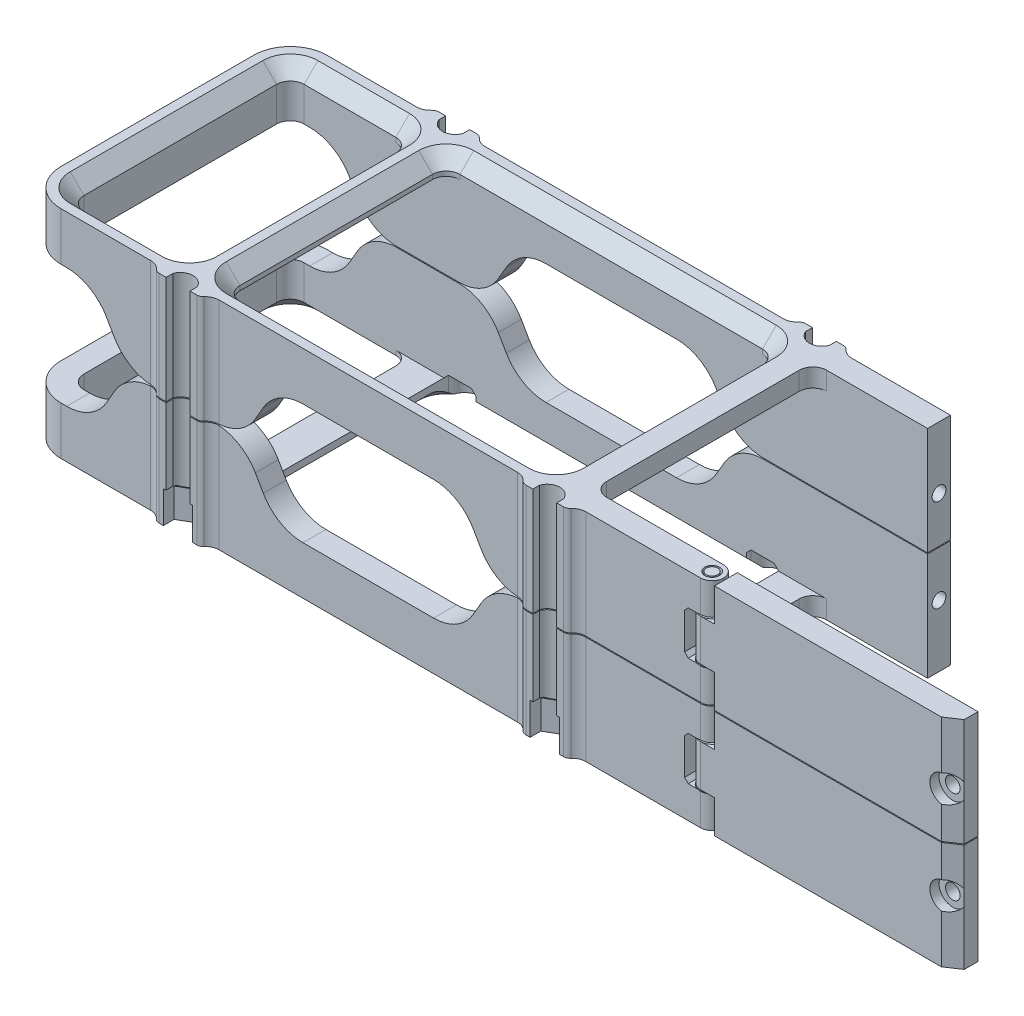
from build123d import *

# Parameters (mm, degrees)
DODANIE_WYCI_GNI_CIE1_DEPTH  = 23.5
WYTNIJ_WYCI_GNI_CIE1_DEPTH   = 86.874385005
ZAOKR_GLENIE1_R              = 8
ZAOKR_GLENIE2_R              = 3
ZAOKR_GLENIE3_R              = 3
SZKIC6_R                     = 1.6
WYTNIJ_WYCI_GNI_CIE4_DEPTH   = 85.305990297
SZKIC7_W                     = 6
SZKIC7_H                     = 9.5
WYTNIJ_WYCI_GNI_CIE5_DEPTH   = 99.577380773
SFAZOWANIE1_SIZE             = 1
SZKIC8_R                     = 1.25
DODANIE_WYCI_GNI_CIE2_DEPTH  = 23.5
SZKIC9_R                     = 2.5
DODANIE_WYCI_GNI_CIE3_DEPTH  = 9.1
SFAZOWANIE2_SIZE             = 1.25
DODANIE_WYCI_GNI_CIE4_DEPTH  = 23.5
DODANIE_WYCI_GNI_CIE5_DEPTH  = 9.1
ZAOKR_GLENIE4_R              = 2.5
SZKIC13_R                    = 1.6
WYTNIJ_WYCI_GNI_CIE6_DEPTH   = 5
SZKIC14_R                    = 1.5
WYTNIJ_WYCI_GNI_CIE7_DEPTH   = 10
SFAZOWANIE3_SIZE             = 2
SFAZOWANIE3_SIZE_2           = 3
SZKIC15_R                    = 3
WYTNIJ_WYCI_GNI_CIE8_DEPTH   = 2
SFAZOWANIE4_SIZE             = 0.8
OBIEKT_PRZENIE_KOPIUJ1_ANGLE = 90
DODANIE_WYCI_GNI_CIE6_DEPTH  = 4
WYTNIJ_WYCI_GNI_CIE9_DEPTH   = 144.096121557
WYTNIJ_WYCI_GNI_CIE10_DEPTH  = 144.096121557
ZAOKR_GLENIE5_R              = 10
ZAOKR_GLENIE6_R              = 3
SFAZOWANIE5_SIZE             = 3
WYTNIJ_WYCI_GNI_CIE11_DEPTH  = 7
SFAZOWANIE6_SIZE             = 0.7
WYTNIJ_WYCI_GNI_CIE12_DEPTH  = 5
SFAZOWANIE7_SIZE             = 1


# Some blends are built 0.0001 mm under size
with BuildPart() as part:
    # Szkic1 → Dodanie-wyciągnięcie1 (new body)
    with BuildSketch(Plane(origin=(0, 0, 0), x_dir=(1, 0, 0), z_dir=(0, 1, 0))):
        with BuildLine():
            Line((-70, -24), (75, -24))
            Line((75, -24), (75, -29))
            Line((75, -29), (45.6, -29))
            ThreePointArc((45.6, -29), (40, -34.6), (34.4, -29))
            Line((34.4, -29), (-34.4, -29))
            ThreePointArc((-34.4, -29), (-40, -34.6), (-45.6, -29))
            Line((-45.6, -29), (-75, -29))
            Line((-75, -29), (-75, -24))
            Line((-75, -24), (-75, 24))
            Line((-75, 24), (-75, 29))
            Line((-75, 29), (-45.6, 29))
            ThreePointArc((-45.6, 29), (-40, 34.6), (-34.4, 29))
            Line((-34.4, 29), (34.4, 29))
            ThreePointArc((34.4, 29), (40, 34.6), (45.6, 29))
            Line((45.6, 29), (69, 29))
            Line((69, 29), (69, 24))
            Line((69, 24), (-70, 24))
            Line((-70, 24), (-70, -24))
        make_face()
    extrude(amount=DODANIE_WYCI_GNI_CIE1_DEPTH)

    # Szkic2 → Wytnij-wyciągnięcie1 (cut, through all)
    with BuildSketch(Plane(origin=(0, 23.5, 0), x_dir=(1, 0, 0), z_dir=(0, 1, 0))):
        with BuildLine():
            Line((-44.1, -30.5), (-42.6, -30.5))
            Line((-42.6, -30.5), (-42.6, -29))
            ThreePointArc((-42.6, -29), (-40, -27.214322345), (-37.4, -29))
            Line((-37.4, -29), (-37.4, -30.5))
            Line((-37.4, -30.5), (-35.9, -30.5))
            ThreePointArc((-35.9, -30.5), (-34.839339828, -30.060660172), (-34.4, -29))
            ThreePointArc((-34.4, -29), (-40, -34.6), (-45.6, -29))
            ThreePointArc((-45.6, -29), (-45.160660172, -30.060660172), (-44.1, -30.5))
        make_face()
        with BuildLine():
            Line((-37.4, 30.5), (-35.9, 30.5))
            ThreePointArc((-35.9, 30.5), (-34.839339828, 30.060660172), (-34.4, 29))
            ThreePointArc((-34.4, 29), (-40, 34.6), (-45.6, 29))
            ThreePointArc((-45.6, 29), (-45.160660172, 30.060660172), (-44.1, 30.5))
            Line((-44.1, 30.5), (-42.6, 30.5))
            Line((-42.6, 30.5), (-42.6, 29))
            ThreePointArc((-42.6, 29), (-40, 27.214322345), (-37.4, 29))
            Line((-37.4, 29), (-37.4, 30.5))
        make_face()
        with BuildLine():
            Line((44.1, 30.5), (42.6, 30.5))
            Line((42.6, 30.5), (42.6, 29))
            ThreePointArc((42.6, 29), (40, 27.214322345), (37.4, 29))
            Line((37.4, 29), (37.4, 30.5))
            Line((37.4, 30.5), (35.9, 30.5))
            ThreePointArc((35.9, 30.5), (34.839339828, 30.060660172), (34.4, 29))
            ThreePointArc((34.4, 29), (40, 34.6), (45.6, 29))
            ThreePointArc((45.6, 29), (45.160660172, 30.060660172), (44.1, 30.5))
        make_face()
        with BuildLine():
            Line((37.4, -30.5), (35.9, -30.5))
            ThreePointArc((35.9, -30.5), (34.839339828, -30.060660172), (34.4, -29))
            ThreePointArc((34.4, -29), (40, -34.6), (45.6, -29))
            ThreePointArc((45.6, -29), (45.160660172, -30.060660172), (44.1, -30.5))
            Line((44.1, -30.5), (42.6, -30.5))
            Line((42.6, -30.5), (42.6, -29))
            ThreePointArc((42.6, -29), (40, -27.214322345), (37.4, -29))
            Line((37.4, -29), (37.4, -30.5))
        make_face()
    extrude(amount=-WYTNIJ_WYCI_GNI_CIE1_DEPTH, mode=Mode.SUBTRACT)

    # Zaokrąglenie1
    zaokr_glenie1_edges = [part.edges().sort_by_distance(p)[0] for p in [
        (-75, 11.75, 29),
        (-75, 11.75, -29),
    ]]
    fillet(zaokr_glenie1_edges, radius=ZAOKR_GLENIE1_R)

    # Zaokrąglenie2
    zaokr_glenie2_edges = [part.edges().sort_by_distance(p)[0] for p in [
        (-70, 11.75, -24),
        (-70, 11.75, 24),
    ]]
    fillet(zaokr_glenie2_edges, radius=ZAOKR_GLENIE2_R)

    # Zaokrąglenie3
    zaokr_glenie3_edges = [part.edges().sort_by_distance(p)[0] for p in [
        (45.6, 11.75, 29),
        (34.4, 11.75, 29),
        (-34.4, 11.75, 29),
        (-45.6, 11.75, 29),
        (-45.6, 11.75, -29),
        (-34.4, 11.75, -29),
        (34.4, 11.75, -29),
        (45.6, 11.75, -29),
    ]]
    fillet(zaokr_glenie3_edges, radius=ZAOKR_GLENIE3_R)

    # Szkic6 → Wytnij-wyciągnięcie4 (cut, through all)
    with BuildSketch(Plane(origin=(0, 23.5, 0), x_dir=(1, 0, 0), z_dir=(0, 1, 0))):
        with Locations(Location((72.5, -26.5, 0), (0, 0, 270))):
            Circle(SZKIC6_R)
    extrude(amount=-WYTNIJ_WYCI_GNI_CIE4_DEPTH, mode=Mode.SUBTRACT)

    # Szkic7 → Wytnij-wyciągnięcie5 (cut, through all)
    with BuildSketch(Plane.XY.offset(29)):
        with Locations((72, 11.75)):
            Rectangle(SZKIC7_W, SZKIC7_H)
    extrude(amount=-WYTNIJ_WYCI_GNI_CIE5_DEPTH, mode=Mode.SUBTRACT)

    # Sfazowanie1
    # the kernel refuses this chamfer: 1 mm, written as the material it takes off along each edge
    with BuildSketch(Plane(origin=(72.5, 7, 26.5), x_dir=(0, 0, 1), z_dir=(-1, 0, 0))) as sfazowanie1_piece_1:
        Polygon((1.6, -SFAZOWANIE1_SIZE), (1.6 + SFAZOWANIE1_SIZE, 0), (1.6, 0), align=None)
    revolve(axis=Axis((72.5, 7, 26.5), (0, 1, 0)), mode=Mode.SUBTRACT)
    with BuildSketch(Plane(origin=(72.5, 16.5, 26.5), x_dir=(0, 0, 1), z_dir=(-1, 0, 0))) as sfazowanie1_piece_2:
        Polygon((1.6 + SFAZOWANIE1_SIZE, 0), (1.6, SFAZOWANIE1_SIZE), (1.6, 0), align=None)
    revolve(axis=Axis((72.5, 16.5, 26.5), (0, 1, 0)), mode=Mode.SUBTRACT)

    # Zaokrąglenie4
    zaokr_glenie4_edges = [part.edges().sort_by_distance(p)[0] for p in [
        (75, 3.5, 24),
        (75, 3.5, 29),
        (75, 20, 29),
        (75, 20, 24),
    ]]
    fillet(zaokr_glenie4_edges, radius=ZAOKR_GLENIE4_R - 0.0001)  # a hair under: the kernel refuses the full size

    # Szkic14 → Wytnij-wyciągnięcie7 (cut)
    with BuildSketch(Plane(origin=(69, 0, 0), x_dir=(0, 0, -1), z_dir=(1, 0, 0))):
        with Locations((26.5, 13.5)):
            Circle(SZKIC14_R)
    extrude(amount=-WYTNIJ_WYCI_GNI_CIE7_DEPTH, mode=Mode.SUBTRACT)

    # Sfazowanie4
    sfazowanie4_edges = [part.edges().sort_by_distance(p)[0] for p in [
        (69, 7, 26.5),
        (69, 16.5, 26.5),
    ]]
    chamfer(sfazowanie4_edges, length=SFAZOWANIE4_SIZE)

    # Szkic16 → Dodanie-wyciągnięcie6 (add)
    with BuildSketch(Plane.XZ):
        Polygon((44, 24), (44, -24), (40, -24), (36, -24), (36, 24), align=None)
        Polygon((-44, -24), (-40, -24), (-36, -24), (-36, 24), (-44, 24), align=None)
    extrude(amount=-DODANIE_WYCI_GNI_CIE6_DEPTH)

    # Szkic17 → Wytnij-wyciągnięcie9 (cut, through all)
    with BuildSketch(Plane.XY.offset(29)):
        Polygon((-75, 10.5), (-60, 10.5), (-52.494446501, 23.5), (-75, 23.5), align=None)
    extrude(amount=-WYTNIJ_WYCI_GNI_CIE9_DEPTH, mode=Mode.SUBTRACT)

    # Szkic18 → Wytnij-wyciągnięcie10 (cut, through all)
    with BuildSketch(Plane.XY.offset(29)):
        Polygon((-27.505553499, 23.5), (-20, 10.5), (20, 10.5), (27.505553499, 23.5), align=None)
    extrude(amount=-WYTNIJ_WYCI_GNI_CIE10_DEPTH, mode=Mode.SUBTRACT)

    # Zaokrąglenie5
    zaokr_glenie5_edges = [part.edges().sort_by_distance(p)[0] for p in [
        (-52.494446501, 23.5, -26.5),
        (-52.494446501, 23.5, 26.5),
        (-27.505553499, 23.5, 26.5),
        (-20, 10.5, 26.5),
        (20, 10.5, 26.5),
        (27.505553499, 23.5, 26.5),
        (-27.505553499, 23.5, -26.5),
        (-20, 10.5, -26.5),
        (20, 10.5, -26.5),
        (27.505553499, 23.5, -26.5),
        (-60, 10.5, -26.5),
        (-60, 10.5, 26.5),
    ]]
    fillet(zaokr_glenie5_edges, radius=ZAOKR_GLENIE5_R)

    # Zaokrąglenie6
    zaokr_glenie6_edges = [part.edges().sort_by_distance(p)[0] for p in [
        (36, 2, -24),
        (36, 2, 24),
        (44, 2, 24),
        (44, 2, -24),
        (-44, 2, -24),
        (-44, 2, 24),
        (-36, 2, 24),
        (-36, 2, -24),
    ]]
    fillet(zaokr_glenie6_edges, radius=ZAOKR_GLENIE6_R)

    # Sfazowanie5
    sfazowanie5_edges = [part.edges().sort_by_distance(p)[0] for p in [
        (-57, 0, -24),
        (-70, 0, 0),
        (-69.121320344, 0, -23.121320344),
        (-69.121320344, 0, 23.121320344),
        (-44, 0, 0),
        (0, 0, -24),
        (0, 0, 24),
        (-57, 0, 24),
        (-36, 0, 0),
        (36, 0, 0),
        (-44.878679656, 0, -23.121320344),
        (-44.878679656, 0, 23.121320344),
        (-35.121320344, 0, 23.121320344),
        (-35.121320344, 0, -23.121320344),
        (35.121320344, 0, -23.121320344),
        (35.121320344, 0, 23.121320344),
    ]]
    chamfer(sfazowanie5_edges, length=SFAZOWANIE5_SIZE)


with BuildPart() as body_2:
    # Szkic8 → Dodanie-wyciągnięcie2 (new body)
    with BuildSketch(Plane.XZ):
        with Locations(Location((72.5, 26.5, 0), (0, 0, 270))):
            Circle(SZKIC8_R)
    extrude(amount=-DODANIE_WYCI_GNI_CIE2_DEPTH)

    # Szkic9 → Dodanie-wyciągnięcie3 (add)
    with BuildSketch(Plane(origin=(0, 7.2, 0), x_dir=(1, 0, 0), z_dir=(0, 1, 0))):
        with Locations(Location((72.5, -26.5, 0), (0, 0, 180))):
            Circle(SZKIC9_R)
    extrude(amount=DODANIE_WYCI_GNI_CIE3_DEPTH)

    # Sfazowanie2
    sfazowanie2_edges = [body_2.edges().sort_by_distance(p)[0] for p in [
        (72.5, 16.3, 27.75),
        (72.5, 7.2, 27.75),
    ]]
    chamfer(sfazowanie2_edges, length=SFAZOWANIE2_SIZE - 0.0001)  # a hair under: the kernel refuses the full size



with BuildPart() as body_3:
    # Szkic10 → Dodanie-wyciągnięcie4 (new body)
    with BuildSketch(Plane(origin=(0, 0, 0), x_dir=(1, 0, 0), z_dir=(0, 1, 0))):
        Polygon((70, 0), (70, 29), (75, 29), (75, -23.5), (70, -23.5), align=None)
    extrude(amount=DODANIE_WYCI_GNI_CIE4_DEPTH)


with BuildPart() as body_2_1:
    add(body_2.part)

    add(body_3.part)  # Dodanie-wyciągnięcie5 merges body 3
    # Szkic12 → Dodanie-wyciągnięcie5 (add)
    with BuildSketch(Plane(origin=(0, 7.2, 0), x_dir=(1, 0, 0), z_dir=(0, 1, 0))):
        with BuildLine():
            Line((75, -26.5), (75, -23.5))
            Line((75, -23.5), (70, -23.5))
            Line((70, -23.5), (70, -26.5))
            ThreePointArc((70, -26.5), (72.5, -29), (75, -26.5))
        make_face()
    extrude(amount=DODANIE_WYCI_GNI_CIE5_DEPTH)

    # Szkic13 → Wytnij-wyciągnięcie6 (cut)
    with BuildSketch(Plane(origin=(75, 0, 0), x_dir=(0, 0, -1), z_dir=(1, 0, 0))):
        with Locations((26.5, 13.5)):
            Circle(SZKIC13_R)
    extrude(amount=-WYTNIJ_WYCI_GNI_CIE6_DEPTH, mode=Mode.SUBTRACT)

    # Sfazowanie3
    # the kernel refuses this chamfer: 3, 2 mm, written as the material it takes off along each edge
    with BuildSketch(Plane(origin=(75, -7.751401572, -29), x_dir=(-0.9988348699755197, 0, -0.04825870409559825), z_dir=(0, 1, 0))) as sfazowanie3_piece_1:
        Polygon((SFAZOWANIE3_SIZE * 0.998834869976, SFAZOWANIE3_SIZE * 0.0482587040956), (-SFAZOWANIE3_SIZE_2 * 0.0482587040956, SFAZOWANIE3_SIZE_2 * 0.998834869976), (0, 0), align=None)
    extrude(amount=39.002803143, mode=Mode.SUBTRACT)

    # Szkic15 → Wytnij-wyciągnięcie8 (cut)
    with BuildSketch(Plane(origin=(75, 0, 0), x_dir=(0, 0, -1), z_dir=(1, 0, 0))):
        with Locations((26.5, 13.5)):
            Circle(SZKIC15_R)
    extrude(amount=-WYTNIJ_WYCI_GNI_CIE8_DEPTH, mode=Mode.SUBTRACT)


with BuildPart() as body_2_2:
    # Obiekt-Przenieś/Kopiuj1: moved
    add(body_2_1.part.rotate(Axis((72.5, 0, 26.5), (0, -1, 0)), OBIEKT_PRZENIE_KOPIUJ1_ANGLE))


with BuildPart() as body_3_2:
    # Lustro1: mirrored copy
    add(part.part.mirror(Plane.ZX.offset(23.6)))


with BuildPart() as body_4:
    # Lustro1 2: mirrored copy
    add(body_2_2.part.mirror(Plane.ZX.offset(23.6)))


with BuildPart() as part_1:
    add(part.part)

    # Szkic19 → Wytnij-wyciągnięcie11 (cut)
    with BuildSketch(Plane.XZ):
        Polygon((40, -26.304958277), (36.8, -28.152479139), (36.8, -31.847520861), (40, -33.695041723), (43.2, -31.847520861), (43.2, -28.152479139), align=None)
        Polygon((-40, -26.304958277), (-43.2, -28.152479139), (-43.2, -31.847520861), (-40, -33.695041723), (-36.8, -31.847520861), (-36.8, -28.152479139), align=None)
        Polygon((-40, 26.304958277), (-36.8, 28.152479139), (-36.8, 31.847520861), (-40, 33.695041723), (-43.2, 31.847520861), (-43.2, 28.152479139), align=None)
        Polygon((40, 26.304958277), (43.2, 28.152479139), (43.2, 31.847520861), (40, 33.695041723), (36.8, 31.847520861), (36.8, 28.152479139), align=None)
    extrude(amount=-WYTNIJ_WYCI_GNI_CIE11_DEPTH, mode=Mode.SUBTRACT)

    # Sfazowanie6
    # the kernel refuses this chamfer: 0.7 mm, written as the material it adds along each edge
    with BuildSketch(Plane(origin=(35.241000041, 7, 29.052568184), x_dir=(-0.01374793830529274, -0.9996219169112968, -0.023812127644089357), z_dir=(0.8660254037844384, 0, -0.5000000000000006))) as sfazowanie6_piece_1_section:
        Polygon((SFAZOWANIE6_SIZE * 0.999621916911, -SFAZOWANIE6_SIZE * 0.0274958766106), (-SFAZOWANIE6_SIZE * 0.0274958766106, -SFAZOWANIE6_SIZE * 0.999621916911), (0, 0), align=None)
    sfazowanie6_piece_1 = extrude(amount=7.295397906, mode=Mode.PRIVATE)
    sfazowanie6_piece_1 = sfazowanie6_piece_1 - Plane(origin=(40, 6.763382755, 30), x_dir=(0.9333456062030596, 0, -0.3589790793088689), z_dir=(0, 1, 0)) * Cylinder(2.785677655, 18, mode=Mode.PRIVATE)
    add(sfazowanie6_piece_1)
    with BuildSketch(Plane(origin=(38.441000041, 7, 25.404869231), x_dir=(0.013747938305290607, -0.9996219169112968, -0.02381212764408566), z_dir=(0.8660254037844384, 0, 0.5000000000000007))) as sfazowanie6_piece_2_section:
        Polygon((SFAZOWANIE6_SIZE * 0.999621916911, -SFAZOWANIE6_SIZE * 0.0274958766106), (-SFAZOWANIE6_SIZE * 0.0274958766106, -SFAZOWANIE6_SIZE * 0.999621916911), (0, 0), align=None)
    sfazowanie6_piece_2 = extrude(amount=7.295397906, mode=Mode.PRIVATE)
    sfazowanie6_piece_2 = sfazowanie6_piece_2 - Plane(origin=(40, 6.763382755, 30), x_dir=(0.9333456062030596, 0, -0.3589790793088689), z_dir=(0, 1, 0)) * Cylinder(2.785677655, 18, mode=Mode.PRIVATE)
    add(sfazowanie6_piece_2)
    with BuildSketch(Plane(origin=(-44.758999959, 7, 29.052568184), x_dir=(-0.013747938305293077, -0.9996219169112968, -0.023812127644089926), z_dir=(0.8660254037844383, 0, -0.5000000000000008))) as sfazowanie6_piece_3_section:
        Polygon((SFAZOWANIE6_SIZE * 0.999621916911, -SFAZOWANIE6_SIZE * 0.0274958766106), (-SFAZOWANIE6_SIZE * 0.0274958766106, -SFAZOWANIE6_SIZE * 0.999621916911), (0, 0), align=None)
    sfazowanie6_piece_3 = extrude(amount=7.295397906, mode=Mode.PRIVATE)
    sfazowanie6_piece_3 = sfazowanie6_piece_3 - Plane(origin=(-40, 6.763382755, 30), x_dir=(-0.9333456062030596, 0, -0.3589790793088689), z_dir=(0, 1, 0)) * Cylinder(2.785677655, 18, mode=Mode.PRIVATE)
    add(sfazowanie6_piece_3)
    with BuildSketch(Plane(origin=(-41.558999959, 7, 25.404869231), x_dir=(0.013747938305292407, -0.9996219169112968, -0.02381212764408879), z_dir=(0.8660254037844385, 0, 0.5000000000000004))) as sfazowanie6_piece_4_section:
        Polygon((SFAZOWANIE6_SIZE * 0.999621916911, -SFAZOWANIE6_SIZE * 0.0274958766106), (-SFAZOWANIE6_SIZE * 0.0274958766106, -SFAZOWANIE6_SIZE * 0.999621916911), (0, 0), align=None)
    sfazowanie6_piece_4 = extrude(amount=7.295397906, mode=Mode.PRIVATE)
    sfazowanie6_piece_4 = sfazowanie6_piece_4 - Plane(origin=(-40, 6.763382755, 30), x_dir=(-0.9333456062030596, 0, -0.3589790793088689), z_dir=(0, 1, 0)) * Cylinder(2.785677655, 18, mode=Mode.PRIVATE)
    add(sfazowanie6_piece_4)
    with BuildSketch(Plane(origin=(-35.241000041, 7, -29.052568184), x_dir=(0.013747938305292723, -0.9996219169112968, 0.023812127644089374), z_dir=(-0.8660254037844387, 0, 0.4999999999999999))) as sfazowanie6_piece_5_section:
        Polygon((SFAZOWANIE6_SIZE * 0.999621916911, -SFAZOWANIE6_SIZE * 0.0274958766106), (-SFAZOWANIE6_SIZE * 0.0274958766106, -SFAZOWANIE6_SIZE * 0.999621916911), (0, 0), align=None)
    sfazowanie6_piece_5 = extrude(amount=7.295397906, mode=Mode.PRIVATE)
    sfazowanie6_piece_5 = sfazowanie6_piece_5 - Plane(origin=(-40, 6.763382755, -30), x_dir=(-0.9333456062030596, 0, 0.3589790793088689), z_dir=(0, 1, 0)) * Cylinder(2.785677655, 18, mode=Mode.PRIVATE)
    add(sfazowanie6_piece_5)
    with BuildSketch(Plane(origin=(-38.441000041, 7, -25.404869231), x_dir=(-0.013747938305294832, -0.9996219169112964, 0.023812127644093076), z_dir=(-0.8660254037844393, 0, -0.4999999999999991))) as sfazowanie6_piece_6_section:
        Polygon((SFAZOWANIE6_SIZE * 0.999621916911, -SFAZOWANIE6_SIZE * 0.0274958766106), (-SFAZOWANIE6_SIZE * 0.0274958766106, -SFAZOWANIE6_SIZE * 0.999621916911), (0, 0), align=None)
    sfazowanie6_piece_6 = extrude(amount=7.295397906, mode=Mode.PRIVATE)
    sfazowanie6_piece_6 = sfazowanie6_piece_6 - Plane(origin=(-40, 6.763382755, -30), x_dir=(-0.9333456062030596, 0, 0.3589790793088689), z_dir=(0, 1, 0)) * Cylinder(2.785677655, 18, mode=Mode.PRIVATE)
    add(sfazowanie6_piece_6)
    with BuildSketch(Plane(origin=(44.758999959, 7, -29.052568184), x_dir=(0.013747938305292723, -0.9996219169112968, 0.023812127644089374), z_dir=(-0.8660254037844387, 0, 0.4999999999999999))) as sfazowanie6_piece_7_section:
        Polygon((SFAZOWANIE6_SIZE * 0.999621916911, -SFAZOWANIE6_SIZE * 0.0274958766106), (-SFAZOWANIE6_SIZE * 0.0274958766106, -SFAZOWANIE6_SIZE * 0.999621916911), (0, 0), align=None)
    sfazowanie6_piece_7 = extrude(amount=7.295397906, mode=Mode.PRIVATE)
    sfazowanie6_piece_7 = sfazowanie6_piece_7 - Plane(origin=(40, 6.763382755, -30), x_dir=(0.9333456062030596, 0, 0.3589790793088689), z_dir=(0, 1, 0)) * Cylinder(2.785677655, 18, mode=Mode.PRIVATE)
    add(sfazowanie6_piece_7)
    with BuildSketch(Plane(origin=(41.558999959, 7, -25.404869231), x_dir=(-0.013747938305292721, -0.9996219169112968, 0.023812127644089374), z_dir=(-0.8660254037844388, 0, -0.49999999999999983))) as sfazowanie6_piece_8_section:
        Polygon((SFAZOWANIE6_SIZE * 0.999621916911, -SFAZOWANIE6_SIZE * 0.0274958766106), (-SFAZOWANIE6_SIZE * 0.0274958766106, -SFAZOWANIE6_SIZE * 0.999621916911), (0, 0), align=None)
    sfazowanie6_piece_8 = extrude(amount=7.295397906, mode=Mode.PRIVATE)
    sfazowanie6_piece_8 = sfazowanie6_piece_8 - Plane(origin=(40, 6.763382755, -30), x_dir=(0.9333456062030596, 0, 0.3589790793088689), z_dir=(0, 1, 0)) * Cylinder(2.785677655, 18, mode=Mode.PRIVATE)
    add(sfazowanie6_piece_8)

    # Szkic20 → Wytnij-wyciągnięcie12 (cut)
    with BuildSketch(Plane.XZ):
        with BuildLine():
            Line((36.5, 25), (36.5, -25))
            ThreePointArc((36.5, -25), (33, -28.5), (29.5, -25))
            Line((29.5, -25), (29.5, 25))
            ThreePointArc((29.5, 25), (33, 28.5), (36.5, 25))
        make_face()
        with BuildLine():
            Line((-36.5, 25), (-36.5, -25))
            ThreePointArc((-36.5, -25), (-33, -28.5), (-29.5, -25))
            Line((-29.5, -25), (-29.5, 25))
            ThreePointArc((-29.5, 25), (-33, 28.5), (-36.5, 25))
        make_face()
    extrude(amount=-WYTNIJ_WYCI_GNI_CIE12_DEPTH, mode=Mode.SUBTRACT)

    # Sfazowanie7
    sfazowanie7_edges = [part_1.edges().sort_by_distance(p)[0] for p in [
        (36.5, 5, 24.5),
        (29.5, 5, 24.5),
        (33, 5, 28.5),
        (29.5, 5, -24.5),
        (36.5, 5, -24.5),
        (33, 5, -28.5),
        (-29.5, 5, 24.5),
        (-36.5, 5, 24.5),
        (-33, 5, 28.5),
        (-36.5, 5, -24.5),
        (-29.5, 5, -24.5),
        (-33, 5, -28.5),
    ]]
    chamfer(sfazowanie7_edges, length=SFAZOWANIE7_SIZE)


solid = Compound([body_2_2.part, body_3_2.part, body_4.part, part_1.part])
